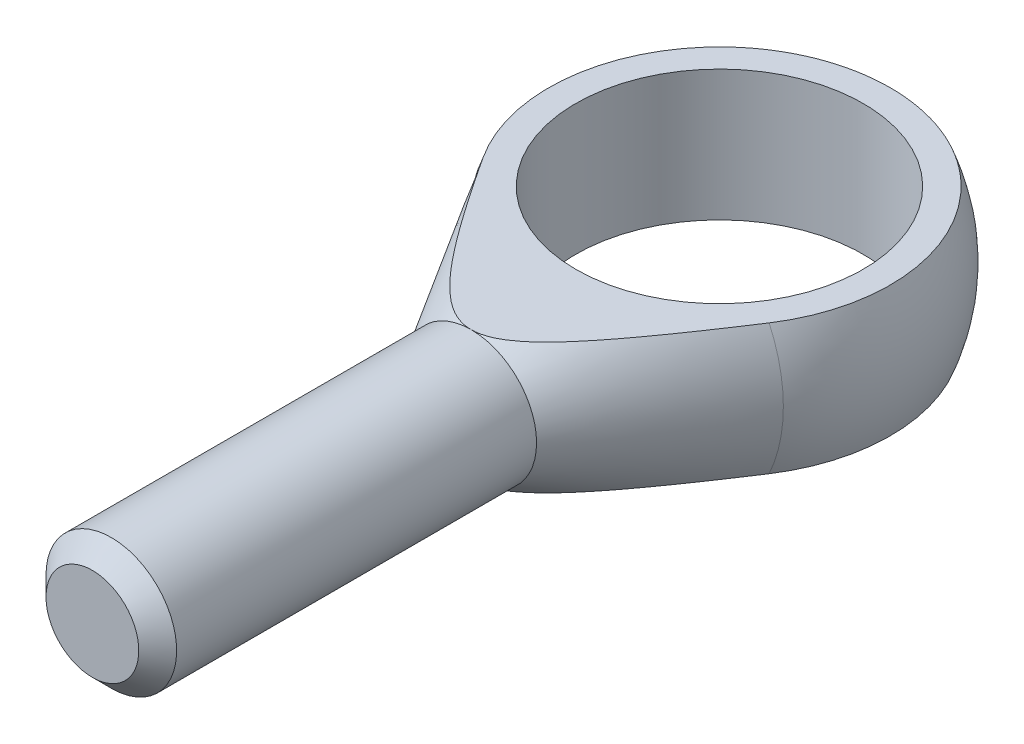
from build123d import *

# Parameters (mm, degrees)
WYTNIJ_WYCI_GNI_CIE1_DEPTH      = 52.923019943
WYTNIJ_WYCI_GNI_CIE1_DEPTH_BACK = 52.923019943
WYTNIJ_WYCI_GNI_CIE2_DEPTH      = 51.249378106
WYTNIJ_WYCI_GNI_CIE2_DEPTH_BACK = 51.249378106
SZKIC3_R                        = 11
SFAZOWANIE1_SIZE                = 1.45


with BuildPart() as part:
    # Szkic1 → Obrót1 (revolve)
    with BuildSketch(Plane(origin=(0, 0, 0), x_dir=(1, 0, 0), z_dir=(0, 1, 0))):
        with BuildLine():
            Line((0, -48), (5, -48))
            Line((5, -48), (5, -19))
            Line((5, -19), (12.037712352, -7.147970434))
            ThreePointArc((12.037712352, -7.147970434), (12.166996056, 6.925619609), (0, 14))
            Line((0, 14), (0, -48))
        make_face()
    revolve(axis=Axis((0, 0, -26.043516498), (0, 0, 1)))

    # Szkic2 → Wytnij-wyciągnięcie1 (cut, two sides: drawn at the far end of the back side and taken through both)
    with BuildSketch(Plane(origin=(0, 0, 0), x_dir=(0, 0, -1), z_dir=(1, 0, 0)).offset(-WYTNIJ_WYCI_GNI_CIE1_DEPTH_BACK)):
        with BuildLine():
            Line((-19, 5), (13.076696831, 5))
            ThreePointArc((13.076696831, 5), (4.601064873, 13.222337238), (-7.147970434, 12.037712352))
            Line((-7.147970434, 12.037712352), (-19, 5))
        make_face()
        with BuildLine():
            Line((-19, -5), (13.076696831, -5))
            ThreePointArc((13.076696831, -5), (4.601064873, -13.222337238), (-7.147970434, -12.037712352))
            Line((-7.147970434, -12.037712352), (-19, -5))
        make_face()
    extrude(amount=WYTNIJ_WYCI_GNI_CIE1_DEPTH + WYTNIJ_WYCI_GNI_CIE1_DEPTH_BACK, mode=Mode.SUBTRACT)

    # Szkic3 → Wytnij-wyciągnięcie2 (cut, two sides: drawn at the far end of the back side and taken through both)
    with BuildSketch(Plane(origin=(0, 0, 0), x_dir=(1, 0, 0), z_dir=(0, 1, 0)).offset(-WYTNIJ_WYCI_GNI_CIE2_DEPTH_BACK)):
        Circle(SZKIC3_R)
    extrude(amount=WYTNIJ_WYCI_GNI_CIE2_DEPTH + WYTNIJ_WYCI_GNI_CIE2_DEPTH_BACK, mode=Mode.SUBTRACT)

    # Sfazowanie1
    sfazowanie1_edges = [part.edges().sort_by_distance(p)[0] for p in [
        (-5, 0, 48),
    ]]
    chamfer(sfazowanie1_edges, length=SFAZOWANIE1_SIZE)


solid = part.part
